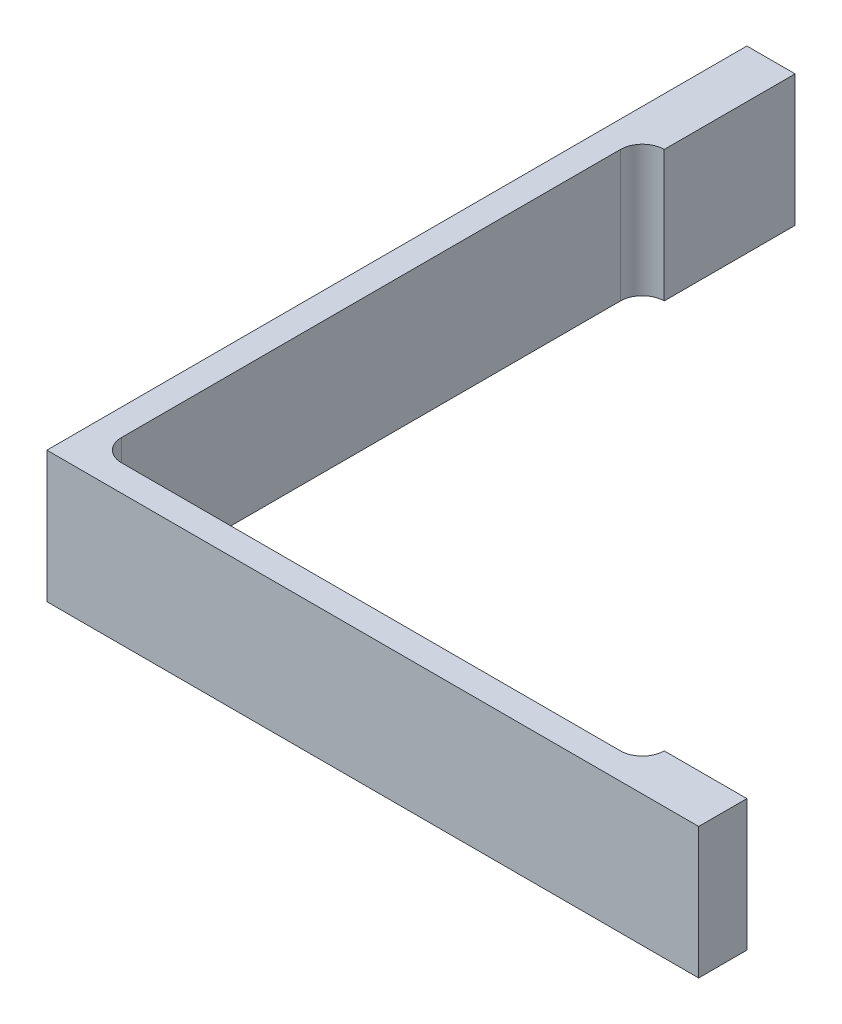
from build123d import *

# Parameters (mm, degrees)
BOSS_EXTRUDE1_DEPTH = 9.525
CUT_EXTRUDE1_DEPTH  = 71.061798614
FILLET1_R           = 1.5875


with BuildPart() as part:
    # Sketch1 → Boss-Extrude1 (new body)
    with BuildSketch(Plane(origin=(0, 0, 0), x_dir=(1, 0, 0), z_dir=(0, 1, 0))):
        Polygon((0, 0), (0, 50.8), (3.5, 50.8), (3.5, 3.5), (47.3, 3.5), (47.3, 0), align=None)
    extrude(amount=BOSS_EXTRUDE1_DEPTH)

    # Sketch2 → Cut-Extrude1 (cut, through all)
    with BuildSketch(Plane(origin=(0, 9.525, 0), x_dir=(1, 0, 0), z_dir=(0, 1, 0))):
        Polygon((3.5, 41.3), (1.9125, 41.3), (1.9125, 3.5), (1.9125, 1.9125), (41.3, 1.9125), (41.3, 3.5), (3.5, 3.5), align=None)
    extrude(amount=-CUT_EXTRUDE1_DEPTH, mode=Mode.SUBTRACT)

    # Fillet1
    fillet1_edges = [part.edges().sort_by_distance(p)[0] for p in [
        (41.3, 4.7625, -1.9125),
        (1.9125, 4.7625, -1.9125),
        (1.9125, 4.7625, -41.3),
    ]]
    fillet(fillet1_edges, radius=FILLET1_R - 0.0001)  # a hair under: the kernel refuses the full size


solid = part.part
